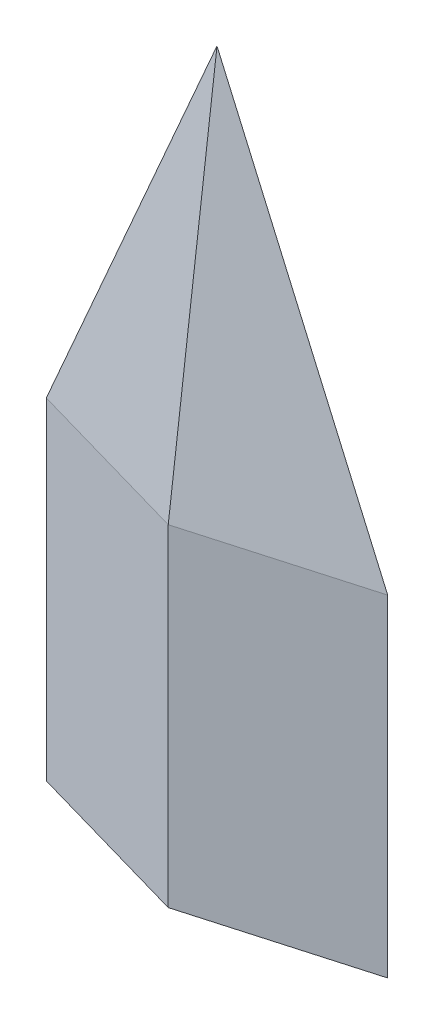
from build123d import *

# Parameters (mm, degrees)
SWEEP_1_DEPTH            = 610
CUT_EXTRUDE_2_DEPTH      = 12
SKETCH_21_R              = 1.75
CUT_EXTRUDE_3_DEPTH      = 600
CUT_EXTRUDE_4_DEPTH      = 691.959477934
CUT_EXTRUDE_4_DEPTH_BACK = 691.959477934
SKETCH_26_W              = 70
SKETCH_26_H              = 530
CUT_EXTRUDE_5_DEPTH      = 41


# Read off the part's stored shape, not the designer's step: 扫描1
with BuildPart() as part:
    # 扫描1 outline → 扫描1 (new body)
    with BuildSketch(Plane(origin=(0, 0, 0), x_dir=(1, 0, 0), z_dir=(0, 1, 0))):
        Polygon((-35, 0), (35, 0), (0, 10), align=None)
    sweep_1 = extrude(amount=SWEEP_1_DEPTH)

    # 草图1 → 放样1 section 0
    with BuildSketch(Plane.XY, mode=Mode.PRIVATE) as loft_1_s0:
        with BuildLine():
            Line((-35, 610), (0, 690))
            Line((0, 690), (35, 610))
            Line((35, 610), (-35, 610))
        make_face()
    loft_1 = loft([Vertex(0, 610, -10), loft_1_s0.sketch])

    # 镜向1: 扫描1, 放样1 across plane
    add(sweep_1.mirror(Plane.XY))
    add(loft_1.mirror(Plane.XY))

    # 草图19 → 切除-拉伸2 (cut)
    with BuildSketch(Plane.XZ):
        Polygon((0, -10), (35, 0), (0, 10), (-35, 0), align=None)
    extrude(amount=-CUT_EXTRUDE_2_DEPTH, mode=Mode.SUBTRACT)

    # 草图21 → 切除-拉伸3 (cut)
    with BuildSketch(Plane.XZ.offset(-12)):
        with Locations(Location((0, 0, 0), (0, 0, 270))):
            Circle(SKETCH_21_R)
    extrude(amount=-CUT_EXTRUDE_3_DEPTH, mode=Mode.SUBTRACT)

    # 草图26 → 切除-拉伸4 (cut, two sides: drawn at the far end of the back side and taken through both)
    with BuildSketch(Plane.XY.offset(-CUT_EXTRUDE_4_DEPTH_BACK)):
        with Locations((0, 277)):
            Rectangle(SKETCH_26_W, SKETCH_26_H)
    extrude(amount=CUT_EXTRUDE_4_DEPTH + CUT_EXTRUDE_4_DEPTH_BACK, mode=Mode.SUBTRACT)

    # 草图27 → 切除-拉伸5 (cut)
    with BuildSketch(Plane.XZ.offset(-542)):
        Polygon((0, -7.087956044), (24.807846155, 0), (0, 7.087956044), (-24.807846155, 0), align=None)
    extrude(amount=-CUT_EXTRUDE_5_DEPTH, mode=Mode.SUBTRACT)


solid = part.part
